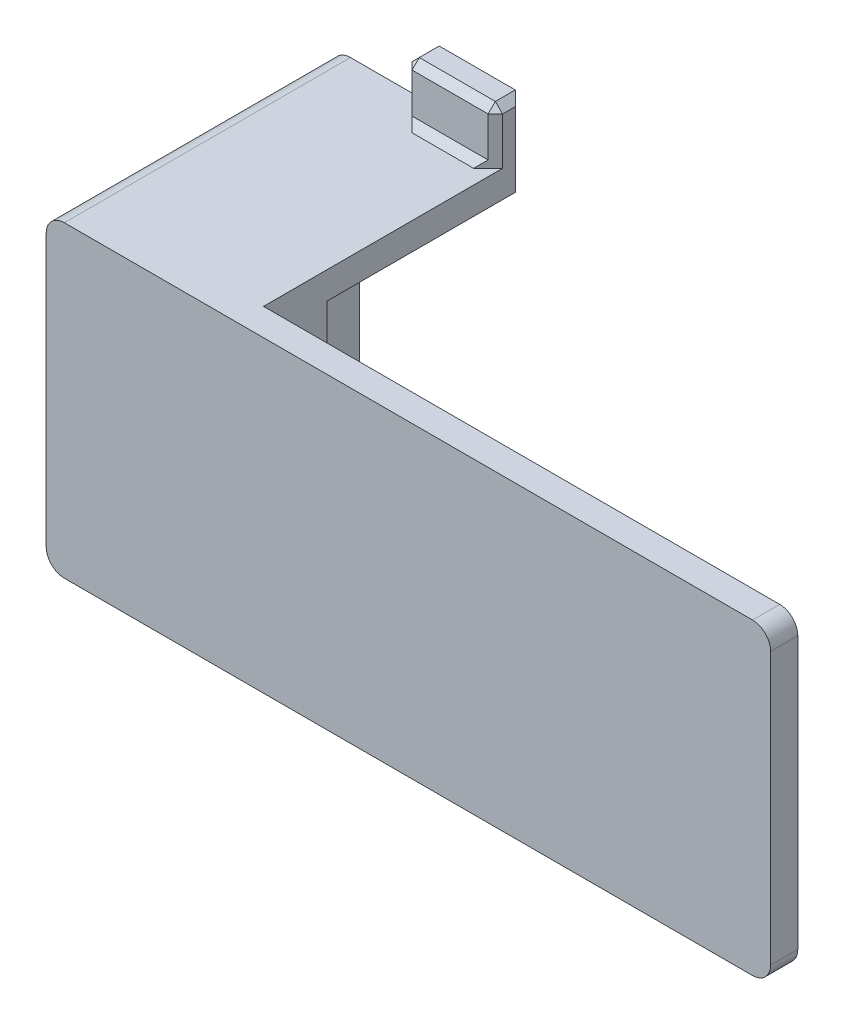
from build123d import *

# Parameters (mm, degrees)
BOSS_EXTRUDE1_DEPTH      = 21.59
BOSS_EXTRUDE1_DEPTH_BACK = 21.59
BOSS_EXTRUDE2_DEPTH      = 6.35
BOSS_EXTRUDE2_DEPTH_BACK = 6.35
SKETCH1_4_W              = 6.35
SKETCH1_4_H              = 3.81
SKETCH3_W                = 26.67
SKETCH3_H                = 31.242
BOSS_EXTRUDE3_DEPTH      = 3.81
FILLET1_R                = 2.54
CHAMFER1_SIZE            = 1.27
SKETCH9_W                = 12.7
SKETCH9_H                = 3.81
BOSS_EXTRUDE6_DEPTH      = 7.62
CHAMFER2_SIZE            = 1.016
CHAMFER3_SIZE            = 1.016
CHAMFER2_OF_MIRROR2_SIZE = 1.016
BOSS_EXTRUDE7_START      = 5.08
BOSS_EXTRUDE7_DEPTH      = 5.08
BOSS_EXTRUDE8_START      = 3.81
BOSS_EXTRUDE8_DEPTH      = 3.81
CHAMFER4_SIZE            = 1.016
SKETCH12_W               = 7.62
SKETCH12_H               = 7.62
CUT_EXTRUDE2_DEPTH       = 3.81
FILLET8_R                = 1.27


with BuildPart() as part:
    # Sketch1 → Boss-Extrude1 (new, two sides: drawn at the far end of the back side and taken through both)
    with BuildSketch(Plane(origin=(0, 0, 0), x_dir=(1, 0, 0), z_dir=(0, 1, 0)).offset(-BOSS_EXTRUDE1_DEPTH_BACK)):
        Polygon((-16.51, 31.242), (-16.51, 0), (10.16, 0), (10.16, 3.81), (-12.7, 3.81), (-12.7, 31.242), align=None)
    extrude(amount=BOSS_EXTRUDE1_DEPTH + BOSS_EXTRUDE1_DEPTH_BACK)

    # Sketch1<4> → Boss-Extrude2 (add, two sides: drawn at the far end of the back side and taken through both)
    with BuildSketch(Plane(origin=(0, 0, 0), x_dir=(1, 0, 0), z_dir=(0, 1, 0)).offset(-BOSS_EXTRUDE2_DEPTH_BACK)):
        with Locations((13.335, 1.905)):
            Rectangle(SKETCH1_4_W, SKETCH1_4_H)
    extrude(amount=BOSS_EXTRUDE2_DEPTH + BOSS_EXTRUDE2_DEPTH_BACK)

    # Sketch3 → Boss-Extrude3 (add)
    with BuildSketch(Plane(origin=(0, 21.59, 0), x_dir=(1, 0, 0), z_dir=(0, 1, 0))):
        with Locations((-3.175, 15.621)):
            Rectangle(SKETCH3_W, SKETCH3_H)
    boss_extrude3 = extrude(amount=-BOSS_EXTRUDE3_DEPTH)

    # Mirror1: Boss-Extrude3 across plane
    add(boss_extrude3.mirror(Plane.ZX))

    # Fillet1
    fillet1_edges = [part.edges().sort_by_distance(p)[0] for p in [
        (-16.51, -21.59, -15.621),
        (-16.51, 21.59, -15.621),
    ]]
    fillet(fillet1_edges, radius=FILLET1_R)

    # Chamfer1
    chamfer1_edges = [part.edges().sort_by_distance(p)[0] for p in [
        (13.335, -6.35, -3.81),
        (16.51, 0, -3.81),
        (16.51, -6.35, -1.905),
        (13.335, 6.35, -3.81),
        (16.51, 6.35, -1.905),
    ]]
    chamfer(chamfer1_edges, length=CHAMFER1_SIZE)

    # Sketch9 → Boss-Extrude6 (add)
    with BuildSketch(Plane.XZ.offset(21.59)):
        with Locations((3.81, -29.337)):
            Rectangle(SKETCH9_W, SKETCH9_H)
    boss_extrude6 = extrude(amount=BOSS_EXTRUDE6_DEPTH)

    # Chamfer2
    chamfer2_edges = [part.edges().sort_by_distance(p)[0] for p in [
        (10.16, -25.4, -27.432),
        (-2.54, -25.4, -27.432),
        (10.16, -29.21, -29.337),
        (3.81, -29.21, -27.432),
        (-2.54, -29.21, -29.337),
    ]]
    chamfer(chamfer2_edges, length=CHAMFER2_SIZE)

    # Chamfer3
    chamfer3_edges = [part.edges().sort_by_distance(p)[0] for p in [
        (3.81, -21.59, -27.432),
        (10.16, -22.987, -31.242),
    ]]
    chamfer(chamfer3_edges, length=CHAMFER3_SIZE)

    # Mirror2: Boss-Extrude6 across plane
    add(boss_extrude6.mirror(Plane.ZX))

    # Chamfer2 of Mirror2
    chamfer2_of_mirror2_edges = [part.edges().sort_by_distance(p)[0] for p in [
        (10.16, 25.4, -27.432),
        (-2.54, 25.4, -27.432),
        (10.16, 29.21, -29.337),
        (3.81, 29.21, -27.432),
        (-2.54, 29.21, -29.337),
    ]]
    chamfer(chamfer2_of_mirror2_edges, length=CHAMFER2_OF_MIRROR2_SIZE)

    # Sketch10 → Boss-Extrude7 (add)
    with BuildSketch(Plane.XY.offset(BOSS_EXTRUDE7_START)):
        with BuildLine():
            Line((10.16, 6.35), (10.16, 21.59))
            Line((10.16, 21.59), (-13.97, 21.59))
            ThreePointArc((-13.97, 21.59), (-15.766051224, 20.846051224), (-16.51, 19.05))
            Line((-16.51, 19.05), (-16.51, -19.05))
            ThreePointArc((-16.51, -19.05), (-15.766051224, -20.846051224), (-13.97, -21.59))
            Line((-13.97, -21.59), (10.16, -21.59))
            Line((10.16, -21.59), (10.16, -6.35))
            Line((10.16, -6.35), (15.24, -6.35))
            Line((15.24, -6.35), (16.51, -5.08))
            Line((16.51, -5.08), (16.51, 5.08))
            Line((16.51, 5.08), (15.24, 6.35))
            Line((15.24, 6.35), (10.16, 6.35))
        make_face()
    extrude(amount=-BOSS_EXTRUDE7_DEPTH)

    # Sketch11 → Boss-Extrude8 (add)
    with BuildSketch(Plane.XY.offset(5.08).offset(BOSS_EXTRUDE8_START)):
        with BuildLine():
            Line((-13.97, 21.59), (82.55, 21.59))
            ThreePointArc((82.55, 21.59), (84.346051224, 20.846051224), (85.09, 19.05))
            Line((85.09, 19.05), (85.09, -19.05))
            ThreePointArc((85.09, -19.05), (84.346051224, -20.846051224), (82.55, -21.59))
            Line((82.55, -21.59), (-13.97, -21.59))
            ThreePointArc((-13.97, -21.59), (-15.766051224, -20.846051224), (-16.51, -19.05))
            Line((-16.51, -19.05), (-16.51, 19.05))
            ThreePointArc((-16.51, 19.05), (-15.766051224, 20.846051224), (-13.97, 21.59))
        make_face()
    extrude(amount=-BOSS_EXTRUDE8_DEPTH)

    # Chamfer4
    chamfer4_edges = [part.edges().sort_by_distance(p)[0] for p in [
        (3.81, 21.59, -27.432),
        (10.16, 22.987, -31.242),
    ]]
    chamfer(chamfer4_edges, length=CHAMFER4_SIZE)

    # Sketch12 → Cut-Extrude2 (cut)
    with BuildSketch(Plane(origin=(-12.7, 0, 0), x_dir=(0, 0, -1), z_dir=(1, 0, 0))):
        with Locations((7.62, -13.97)):
            Rectangle(SKETCH12_W, SKETCH12_H)
    extrude(amount=-CUT_EXTRUDE2_DEPTH, mode=Mode.SUBTRACT)

    # Fillet8
    fillet8_edges = [part.edges().sort_by_distance(p)[0] for p in [
        (-12.7, -13.97, -11.43),
        (-12.7, -10.16, -7.62),
        (-16.51, -17.78, -7.62),
        (-16.51, -13.97, -11.43),
        (-16.51, -10.16, -7.62),
        (-16.51, -13.97, -3.81),
    ]]
    fillet(fillet8_edges, radius=FILLET8_R - 0.0001)  # a hair under: the kernel refuses the full size


solid = part.part
